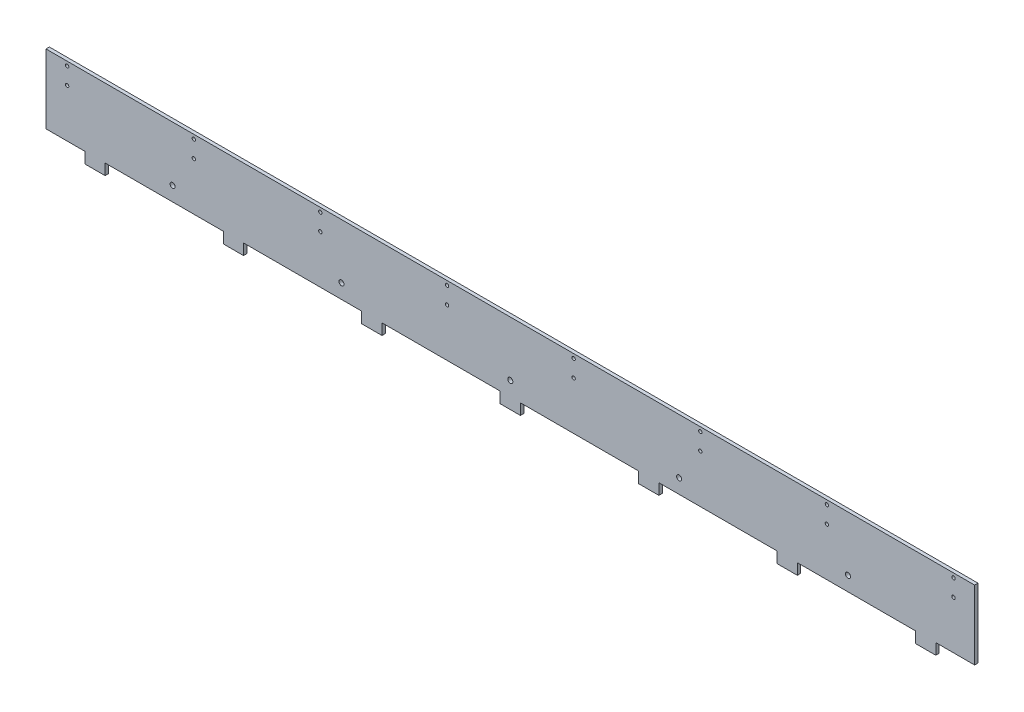
from build123d import *

# Parameters (mm, degrees)
SKETCH_1_W             = 1100
SKETCH_1_H             = 95
EXTRUDE_1_DEPTH        = 2
SKETCH_2_W             = 46
SKETCH_2_H             = 13
SKETCH_2_W_2           = 140
CUT_EXTRUDE_1_DEPTH    = 553.061817191
SKETCH_3_R             = 2
CUT_EXTRUDE_2_DEPTH    = 553.061817191
PATTERN_LINEAR_1_COUNT = 8
PATTERN_LINEAR_1_PITCH = 150
SKETCH_4_R             = 3
CUT_EXTRUDE_3_DEPTH    = 553.061817191
PATTERN_LINEAR_2_COUNT = 5
PATTERN_LINEAR_2_PITCH = 200


with BuildPart() as part:
    # Эскиз1 → Бобышка-Вытянуть1 (new, symmetric)
    with BuildSketch(Plane.XY):
        Rectangle(SKETCH_1_W, SKETCH_1_H)
    extrude(amount=EXTRUDE_1_DEPTH, both=True)

    # Эскиз2 → Вырез-Вытянуть1 (cut, through all)
    with BuildSketch(Plane.XY.offset(2)):
        with Locations((-527, -41)):
            Rectangle(SKETCH_2_W, SKETCH_2_H)
        with Locations((527, -41)):
            Rectangle(SKETCH_2_W, SKETCH_2_H)
        with Locations((-410, -41)):
            Rectangle(SKETCH_2_W_2, SKETCH_2_H)
        with Locations((-246, -41)):
            Rectangle(SKETCH_2_W_2, SKETCH_2_H)
        with Locations((-82, -41)):
            Rectangle(SKETCH_2_W_2, SKETCH_2_H)
        with Locations((82, -41)):
            Rectangle(SKETCH_2_W_2, SKETCH_2_H)
        with Locations((246, -41)):
            Rectangle(SKETCH_2_W_2, SKETCH_2_H)
        with Locations((410, -41)):
            Rectangle(SKETCH_2_W_2, SKETCH_2_H)
    extrude(amount=-CUT_EXTRUDE_1_DEPTH, mode=Mode.SUBTRACT)

    # Эскиз3 → Вырез-Вытянуть2 (cut, through all)
    with BuildSketch(Plane.XY.offset(2)):
        with Locations((-525, 42.5)):
            Circle(SKETCH_3_R)
        with Locations((-525, 22.5)):
            Circle(SKETCH_3_R)
    cut_extrude_2 = extrude(amount=-CUT_EXTRUDE_2_DEPTH, mode=Mode.SUBTRACT)

    # Линейный массив1: Вырез-Вытянуть2 ×8
    with Locations(*[(i * PATTERN_LINEAR_1_PITCH, 0, 0) for i in range(1, PATTERN_LINEAR_1_COUNT)]):
        add(cut_extrude_2, mode=Mode.SUBTRACT)

    # Эскиз4 → Вырез-Вытянуть3 (cut, through all)
    with BuildSketch(Plane(origin=(0, 0, -2), x_dir=(-1, 0, 0), z_dir=(0, 0, -1))):
        with Locations((-400, -17.5)):
            Circle(SKETCH_4_R)
    cut_extrude_3 = extrude(amount=-CUT_EXTRUDE_3_DEPTH, mode=Mode.SUBTRACT)

    # Линейный массив2: Вырез-Вытянуть3 ×5
    with Locations(*[(-i * PATTERN_LINEAR_2_PITCH, 0, 0) for i in range(1, PATTERN_LINEAR_2_COUNT)]):
        add(cut_extrude_3, mode=Mode.SUBTRACT)


solid = part.part
